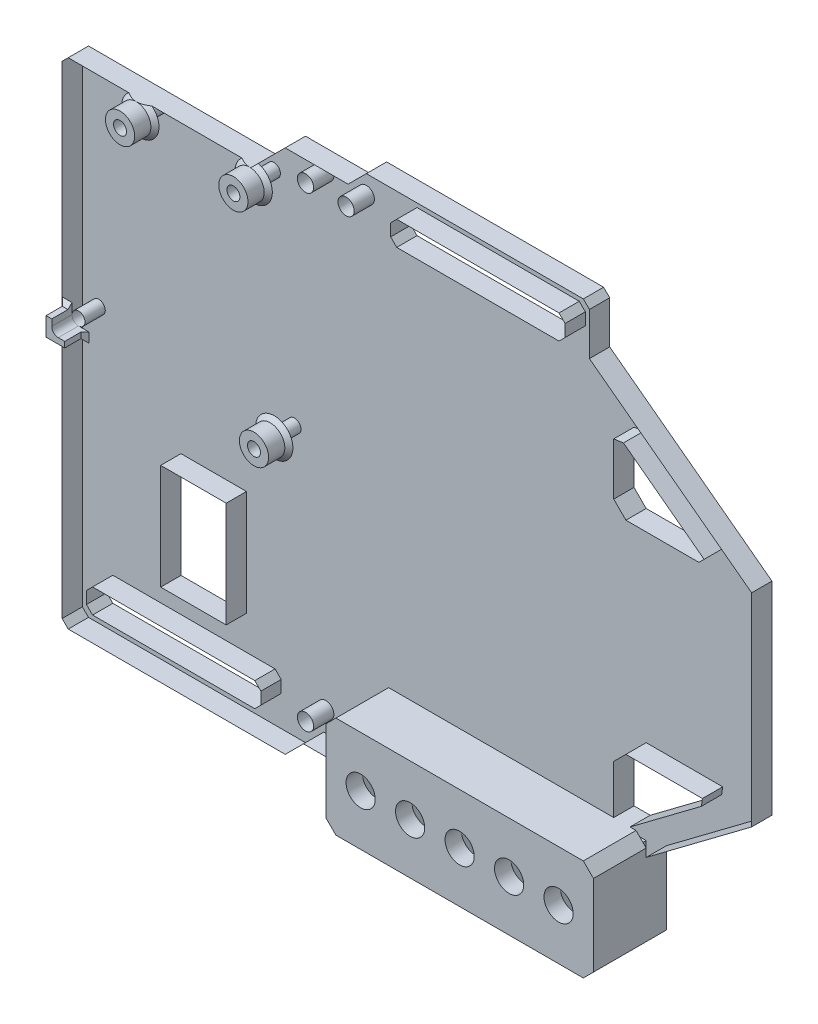
from build123d import *
from OCP.BRepFilletAPI import BRepFilletAPI_MakeChamfer

# Parameters (mm, degrees)
SKETCH1_R           = 2
BOSS_EXTRUDE1_DEPTH = 5
SKETCH4_R           = 3.6
SKETCH4_R_2         = 1.6
BOSS_EXTRUDE2_DEPTH = 5
CUT_EXTRUDE1_START  = -10
SKETCH5_R           = 1.6
SKETCH5_R_2         = 1.5972034
CUT_EXTRUDE1_DEPTH  = 10
CHAMFER1_SIZE       = 1
SKETCH6_W           = 16.15
SKETCH6_H           = 26
CUT_EXTRUDE2_DEPTH  = 10
BOSS_EXTRUDE3_DEPTH = 5
CHAMFER3_SIZE       = 3
CHAMFER3_SIZE2      = 2.142857143
SKETCH10_W          = 43
SKETCH10_H          = 6
CUT_EXTRUDE3_DEPTH  = 10
CHAMFER4_SIZE       = 1.5
SKETCH11_W          = 66
SKETCH11_H          = 25
BOSS_EXTRUDE4_DEPTH = 13
SKETCH12_W          = 66
SKETCH12_H          = 25
BOSS_EXTRUDE5_DEPTH = 5
CUT_EXTRUDE4_START  = -4
SKETCH13_W          = 7.2
SKETCH13_H          = 13.2
CUT_EXTRUDE4_DEPTH  = 14
SKETCH15_R          = 3.6
CUT_EXTRUDE6_DEPTH  = 18
BOSS_EXTRUDE6_DEPTH = 5
CHAMFER5_SIZE       = 2.5


with BuildPart() as part:
    # Sketch1 → Boss-Extrude1 (new body)
    with BuildSketch(Plane.XY):
        Polygon((65, -55), (17.5, -55), (10, -62.5), (-10, -62.5), (-17.5, -55), (-65, -55), (-65, 55), (-17.5, 55), (-10, 62.5), (10, 62.5), (17.5, 55), (65, 55), align=None)
        with Locations((-5, 57.5)):
            Circle(SKETCH1_R, mode=Mode.SUBTRACT)
        with Locations(Location((5, 57.5, 0), (0, 0, 180))):
            Circle(SKETCH1_R, mode=Mode.SUBTRACT)
        with Locations((5, -57.5)):
            Circle(SKETCH1_R, mode=Mode.SUBTRACT)
        with Locations(Location((-5, -57.5, 0), (0, 0, 180))):
            Circle(SKETCH1_R, mode=Mode.SUBTRACT)
    extrude(amount=BOSS_EXTRUDE1_DEPTH)

    # Sketch4 → Boss-Extrude2 (add)
    # profile 1 of 4: a face of its own
    with BuildSketch(Plane.XY.offset(5)):
        with BuildLine():
            Line((-62.56, 2.2), (-63.96, 2.2))
            Line((-63.96, 2.2), (-63.96, -2.4))
            Line((-63.96, -2.4), (-59.36, -2.4))
            Line((-59.36, -2.4), (-59.36, -1))
            Line((-59.36, -1), (-60.96, -1))
            ThreePointArc((-60.96, -1), (-62.09137085, -0.53137085), (-62.56, 0.6))
            Line((-62.56, 0.6), (-62.56, 2.2))
        make_face()
    # profile 2 of 4: a face of its own
    with BuildSketch(Plane.XY.offset(5)):
        with Locations(Location((-12.7, -0.64, 0), (0, 0, 180))):
            Circle(SKETCH4_R)
        with Locations((-12.7, -0.64)):
            Circle(SKETCH4_R_2, mode=Mode.SUBTRACT)
    # profile 3 of 4: a face of its own
    with BuildSketch(Plane.XY.offset(5)):
        with Locations(Location((-17.78, 51.4, 0), (0, 0, 90))):
            Circle(SKETCH4_R)
        with Locations((-17.78, 51.4)):
            Circle(SKETCH4_R_2, mode=Mode.SUBTRACT)
    # profile 4 of 4: a face of its own
    with BuildSketch(Plane.XY.offset(5)):
        with Locations(Location((-45.72, 51.4, 0), (0, 0, 90))):
            Circle(SKETCH4_R)
        with Locations((-45.72, 51.4)):
            Circle(SKETCH4_R_2, mode=Mode.SUBTRACT)
    extrude(amount=BOSS_EXTRUDE2_DEPTH)

    # Sketch5 → Cut-Extrude1 (cut)
    with BuildSketch(Plane.XY.offset(10).offset(CUT_EXTRUDE1_START)):
        with Locations(Location((-45.72, 51.4, 0), (0, 0, 180))):
            Circle(SKETCH5_R)
        with Locations(Location((-17.78, 51.4, 0), (0, 0, 180))):
            Circle(SKETCH5_R)
        with Locations(Location((-12.7, -0.64, 0), (0, 0, 180))):
            Circle(SKETCH5_R)
        with Locations(Location((-60.962264225, 0.59835858, 0), (0, 0, 215.939730973))):
            Circle(SKETCH5_R_2)
    extrude(amount=CUT_EXTRUDE1_DEPTH, mode=Mode.SUBTRACT)

    # Chamfer1
    # the kernel refuses this chamfer: 1 mm, written as the material it adds along each edge
    with BuildSketch(Plane(origin=(-63.96, 2.2, 5), x_dir=(-0.9996219169112968, 0, -0.027495876610586795), z_dir=(0, -1, 0)), Plane(origin=(-63.96, -2.4, 5), x_dir=(0, -0.9996219169112968, -0.027495876610586487), z_dir=(1, 0, 0))) as chamfer1_piece_1:
        Polygon((CHAMFER1_SIZE * 0.999621916911, -CHAMFER1_SIZE * 0.0274958766106), (-CHAMFER1_SIZE * 0.0274958766106, -CHAMFER1_SIZE * 0.999621916911), (0, 0), align=None)
    extrude(amount=4.6)
    with BuildSketch(Plane(origin=(-59.36, -2.4, 5), x_dir=(0.9996219169112968, 0, -0.027495876610586414), z_dir=(0, 1, 0)), Plane(origin=(-62.56, 2.2, 5), x_dir=(0, 0.9996219169112968, -0.027495876610586487), z_dir=(-1, 0, 0))) as chamfer1_piece_2:
        Polygon((CHAMFER1_SIZE * 0.999621916911, -CHAMFER1_SIZE * 0.0274958766106), (-CHAMFER1_SIZE * 0.0274958766106, -CHAMFER1_SIZE * 0.999621916911), (0, 0), align=None)
    extrude(amount=1.4)
    with BuildSketch(Plane(origin=(-12.7, -0.64, 5), x_dir=(-1, 0, 0), z_dir=(0, 1, 0))) as chamfer1_piece_3:
        Polygon((3.6 + CHAMFER1_SIZE, 0), (3.6, CHAMFER1_SIZE), (3.6, 0), align=None)
    revolve(axis=Axis((-12.7, -0.64, 5), (0, 0, 1)))
    with BuildSketch(Plane(origin=(-17.78, 51.4, 5), x_dir=(0, 1, 0), z_dir=(1, 0, 0))) as chamfer1_piece_4_section:
        Polygon((3.6 + CHAMFER1_SIZE, 0), (3.6, CHAMFER1_SIZE), (3.6, 0), align=None)
    chamfer1_piece_4 = revolve(axis=Axis((-17.78, 51.4, 5), (0, 0, 1)), mode=Mode.PRIVATE)
    chamfer1_piece_4 = split(chamfer1_piece_4, bisect_by=Plane(origin=(-20.090607532, 52.409392468, 5.333813393), z_dir=(-0.7071067811865521, 0.707106781186543, 0)), keep=Keep.TOP, mode=Mode.PRIVATE)
    chamfer1_piece_4 = split(chamfer1_piece_4, bisect_by=Plane(origin=(-20.897674884, 55, 5.333813393), z_dir=(0, -1, 0)), keep=Keep.TOP, mode=Mode.PRIVATE)
    add(chamfer1_piece_4)
    with BuildSketch(Plane(origin=(-17.78, 51.4, 5), x_dir=(0, 1, 0), z_dir=(1, 0, 0))) as chamfer1_piece_5_section:
        Polygon((3.6 + CHAMFER1_SIZE, 0), (3.6, CHAMFER1_SIZE), (3.6, 0), align=None)
    chamfer1_piece_5 = revolve(axis=Axis((-17.78, 51.4, 5), (0, 0, 1)), mode=Mode.PRIVATE)
    chamfer1_piece_5 = split(chamfer1_piece_5, bisect_by=Plane(origin=(-16.893463723, 55.606536277, 5.257332972), z_dir=(0.7071067811865521, -0.707106781186543, 0)), keep=Keep.TOP, mode=Mode.PRIVATE)
    chamfer1_piece_5 = split(chamfer1_piece_5, bisect_by=Plane(origin=(-16.518343034, 55, 5.257332972), z_dir=(0, 1, 0)), keep=Keep.TOP, mode=Mode.PRIVATE)
    add(chamfer1_piece_5)
    with BuildSketch(Plane(origin=(-17.78, 51.4, 5), x_dir=(0, 1, 0), z_dir=(1, 0, 0))) as chamfer1_piece_6_section:
        Polygon((3.6 + CHAMFER1_SIZE, 0), (3.6, CHAMFER1_SIZE), (3.6, 0), align=None)
    chamfer1_piece_6 = revolve(axis=Axis((-17.78, 51.4, 5), (0, 0, 1)), mode=Mode.PRIVATE)
    chamfer1_piece_6 = split(chamfer1_piece_6, bisect_by=Plane(origin=(-19.44, 53.06, 5.485263694), z_dir=(0.7071067811865521, -0.707106781186543, 0)), keep=Keep.TOP, mode=Mode.PRIVATE)
    chamfer1_piece_6 = split(chamfer1_piece_6, bisect_by=Plane(origin=(-14.891282339, 55, 5.485263694), z_dir=(0, -1, 0)), keep=Keep.TOP, mode=Mode.PRIVATE)
    add(chamfer1_piece_6)
    with BuildSketch(Plane(origin=(-45.72, 51.4, 5), x_dir=(0, 1, 0), z_dir=(1, 0, 0))) as chamfer1_piece_7_section:
        Polygon((3.6 + CHAMFER1_SIZE, 0), (3.6, CHAMFER1_SIZE), (3.6, 0), align=None)
    chamfer1_piece_7 = revolve(axis=Axis((-45.72, 51.4, 5), (0, 0, 1)), mode=Mode.PRIVATE)
    chamfer1_piece_7 = split(chamfer1_piece_7, bisect_by=Plane(origin=(-45.72, 55, 5.483834366), z_dir=(0, -1, 0)), keep=Keep.TOP, mode=Mode.PRIVATE)
    add(chamfer1_piece_7)
    with BuildSketch(Plane(origin=(-63.96, 4.771682988, 5), x_dir=(-0.9996219169112968, 0, -0.027495876610586795), z_dir=(0, -1, 0))) as chamfer1_piece_8a_section:
        Polygon((CHAMFER1_SIZE * 0.999621916911, -CHAMFER1_SIZE * 0.0274958766106), (-CHAMFER1_SIZE * 0.0274958766106, -CHAMFER1_SIZE * 0.999621916911), (0, 0), align=None)
    chamfer1_piece_8a = extrude(amount=7.171682988, mode=Mode.PRIVATE)
    chamfer1_piece_8a = split(chamfer1_piece_8a, bisect_by=Plane(origin=(-64.289793627, 2.2, 5.329793627), z_dir=(0, 1, 0)), keep=Keep.TOP, mode=Mode.PRIVATE)
    with BuildSketch(Plane(origin=(-62.56, 2.2, 5), x_dir=(0, 0.9996219169112968, -0.027495876610586487), z_dir=(-1, 0, 0))) as chamfer1_piece_8b_section:
        Polygon((CHAMFER1_SIZE * 0.999621916911, -CHAMFER1_SIZE * 0.0274958766106), (-CHAMFER1_SIZE * 0.0274958766106, -CHAMFER1_SIZE * 0.999621916911), (0, 0), align=None)
    chamfer1_piece_8b = extrude(amount=3.971682988, mode=Mode.PRIVATE)
    chamfer1_piece_8b = split(chamfer1_piece_8b, bisect_by=Plane(origin=(-65, 2.529793627, 5.329793627), z_dir=(1, 0, 0)), keep=Keep.TOP, mode=Mode.PRIVATE)
    chamfer1_piece_8b = split(chamfer1_piece_8b, bisect_by=Plane(origin=(-63.96, 2.529793627, 5.329793627), z_dir=(-1, 0, 0)), keep=Keep.TOP, mode=Mode.PRIVATE)
    chamfer1_piece_8 = chamfer1_piece_8a & chamfer1_piece_8b
    add(chamfer1_piece_8)
    with BuildSketch(Plane(origin=(-66.531682988, -2.4, 5), x_dir=(0, -0.9996219169112968, -0.027495876610586487), z_dir=(1, 0, 0))) as chamfer1_piece_9a_section:
        Polygon((CHAMFER1_SIZE * 0.999621916911, -CHAMFER1_SIZE * 0.0274958766106), (-CHAMFER1_SIZE * 0.0274958766106, -CHAMFER1_SIZE * 0.999621916911), (0, 0), align=None)
    chamfer1_piece_9a = extrude(amount=7.171682988, mode=Mode.PRIVATE)
    chamfer1_piece_9a = split(chamfer1_piece_9a, bisect_by=Plane(origin=(-65, -2.729793627, 5.329793627), z_dir=(1, 0, 0)), keep=Keep.TOP, mode=Mode.PRIVATE)
    chamfer1_piece_9a = split(chamfer1_piece_9a, bisect_by=Plane(origin=(-63.96, -2.729793627, 5.329793627), z_dir=(-1, 0, 0)), keep=Keep.TOP, mode=Mode.PRIVATE)
    with BuildSketch(Plane(origin=(-63.96, 2.2, 5), x_dir=(-0.9996219169112968, 0, -0.027495876610586795), z_dir=(0, -1, 0))) as chamfer1_piece_9b_section:
        Polygon((CHAMFER1_SIZE * 0.999621916911, -CHAMFER1_SIZE * 0.0274958766106), (-CHAMFER1_SIZE * 0.0274958766106, -CHAMFER1_SIZE * 0.999621916911), (0, 0), align=None)
    chamfer1_piece_9b = extrude(amount=7.171682988, mode=Mode.PRIVATE)
    chamfer1_piece_9b = split(chamfer1_piece_9b, bisect_by=Plane(origin=(-64.289793627, -2.4, 5.329793627), z_dir=(0, -1, 0)), keep=Keep.TOP, mode=Mode.PRIVATE)
    chamfer1_piece_9 = chamfer1_piece_9a & chamfer1_piece_9b
    add(chamfer1_piece_9)
    with BuildSketch(Plane(origin=(-59.36, -4.971682988, 5), x_dir=(0.9996219169112968, 0, -0.027495876610586414), z_dir=(0, 1, 0))) as chamfer1_piece_10a_section:
        Polygon((CHAMFER1_SIZE * 0.999621916911, -CHAMFER1_SIZE * 0.0274958766106), (-CHAMFER1_SIZE * 0.0274958766106, -CHAMFER1_SIZE * 0.999621916911), (0, 0), align=None)
    chamfer1_piece_10a = extrude(amount=3.971682988, mode=Mode.PRIVATE)
    chamfer1_piece_10a = split(chamfer1_piece_10a, bisect_by=Plane(origin=(-59.030206373, -2.4, 5.329793627), z_dir=(0, -1, 0)), keep=Keep.TOP, mode=Mode.PRIVATE)
    with BuildSketch(Plane(origin=(-63.96, -2.4, 5), x_dir=(0, -0.9996219169112968, -0.027495876610586487), z_dir=(1, 0, 0))) as chamfer1_piece_10b_section:
        Polygon((CHAMFER1_SIZE * 0.999621916911, -CHAMFER1_SIZE * 0.0274958766106), (-CHAMFER1_SIZE * 0.0274958766106, -CHAMFER1_SIZE * 0.999621916911), (0, 0), align=None)
    chamfer1_piece_10b = extrude(amount=7.171682988, mode=Mode.PRIVATE)
    chamfer1_piece_10b = split(chamfer1_piece_10b, bisect_by=Plane(origin=(-59.36, -2.729793627, 5.329793627), z_dir=(1, 0, 0)), keep=Keep.TOP, mode=Mode.PRIVATE)
    chamfer1_piece_10 = chamfer1_piece_10a & chamfer1_piece_10b
    add(chamfer1_piece_10)

    # Sketch6 → Cut-Extrude2 (cut)
    with BuildSketch(Plane.XY.offset(5)):
        with Locations((-32.625, -33.64)):
            Rectangle(SKETCH6_W, SKETCH6_H)
    extrude(amount=-CUT_EXTRUDE2_DEPTH, mode=Mode.SUBTRACT)

    # Sketch9 → Boss-Extrude3 (add)
    # profile 1 of 3: a face of its own
    with BuildSketch(Plane.XY.offset(5)):
        Polygon((105, -25), (65, -55), (65, 55), (105, 25), align=None)
        Polygon((71, 43), (71, 25), (95, 25), align=None, mode=Mode.SUBTRACT)
        Polygon((71, -25), (95, -25), (71, -43), align=None, mode=Mode.SUBTRACT)
    # profile 2 of 3: a face of its own
    with BuildSketch(Plane.XY.offset(5)):
        Polygon((17.5, 55), (65, 55), (65, 67), (10, 67), (5.5, 62.5), (10, 62.5), align=None)
    # profile 3 of 3: a face of its own
    with BuildSketch(Plane.XY.offset(5)):
        Polygon((-17.5, -55), (-65, -55), (-65, -67), (-10, -67), (-5.5, -62.5), (-10, -62.5), align=None)
    extrude(amount=-BOSS_EXTRUDE3_DEPTH)

    # Chamfer3: one chamfer whose edges measure the first distance from different faces: ONE call of the kernel's chamfer builder (chamfer() names one face for all edges)
    chamfer3_edges_1 = [part.edges().sort_by_distance(p)[0] for p in [
        (95, 25, 2.5),
    ]]
    chamfer3_side_1 = [part.faces().sort_by_distance(p)[0] for p in [
        (83, 25, 2.5),
    ]]
    chamfer3_edges_2 = [part.edges().sort_by_distance(p)[0] for p in [
        (71, 25, 2.5),
        (71, -25, 2.5),
    ]]
    chamfer3_edges_3 = [part.edges().sort_by_distance(p)[0] for p in [
        (71, 43, 2.5),
    ]]
    chamfer3_side_3 = [part.faces().sort_by_distance(p)[0] for p in [
        (83, 34, 2.5),
    ]]
    chamfer3_edges_4 = [part.edges().sort_by_distance(p)[0] for p in [
        (71, -43, 2.5),
    ]]
    chamfer3_side_4 = [part.faces().sort_by_distance(p)[0] for p in [
        (71, -34, 2.5),
    ]]
    chamfer3_edges_5 = [part.edges().sort_by_distance(p)[0] for p in [
        (95, -25, 2.5),
    ]]
    chamfer3_side_5 = [part.faces().sort_by_distance(p)[0] for p in [
        (83, -34, 2.5),
    ]]
    chamfer3 = BRepFilletAPI_MakeChamfer(part.part.solid().wrapped)
    for e in chamfer3_edges_1:
        chamfer3.Add(CHAMFER3_SIZE, CHAMFER3_SIZE2, e.wrapped, chamfer3_side_1[0].wrapped)  # the first distance lies on this face
    for e in chamfer3_edges_2:
        chamfer3.Add(CHAMFER3_SIZE, e.wrapped)
    for e in chamfer3_edges_3:
        chamfer3.Add(CHAMFER3_SIZE, CHAMFER3_SIZE2, e.wrapped, chamfer3_side_3[0].wrapped)  # the first distance lies on this face
    for e in chamfer3_edges_4:
        chamfer3.Add(CHAMFER3_SIZE, CHAMFER3_SIZE2, e.wrapped, chamfer3_side_4[0].wrapped)  # the first distance lies on this face
    for e in chamfer3_edges_5:
        chamfer3.Add(CHAMFER3_SIZE, CHAMFER3_SIZE2, e.wrapped, chamfer3_side_5[0].wrapped)  # the first distance lies on this face
    add(Compound.cast(chamfer3.Shape()), mode=Mode.REPLACE)

    # Sketch10 → Cut-Extrude3 (cut)
    with BuildSketch(Plane.XY.offset(5)):
        with Locations((-37.5, -58)):
            Rectangle(SKETCH10_W, SKETCH10_H)
        with Locations((37.5, 58)):
            Rectangle(SKETCH10_W, SKETCH10_H)
    extrude(amount=-CUT_EXTRUDE3_DEPTH, mode=Mode.SUBTRACT)

    # Chamfer4
    chamfer4_edges = [part.edges().sort_by_distance(p)[0] for p in [
        (65, 67, 2.5),
        (-65, 55, 2.5),
        (-65, -67, 2.5),
        (-59, -61, 2.5),
        (-59, -55, 2.5),
        (-16, -55, 2.5),
        (-16, -61, 2.5),
        (59, 61, 2.5),
        (59, 55, 2.5),
        (16, 55, 2.5),
        (16, 61, 2.5),
    ]]
    chamfer(chamfer4_edges, length=CHAMFER4_SIZE)

    # Sketch11 → Boss-Extrude4 (add)
    with BuildSketch(Plane.XY.offset(5)):
        with Locations((46, -52.5)):
            Rectangle(SKETCH11_W, SKETCH11_H)
    extrude(amount=BOSS_EXTRUDE4_DEPTH)

    # Sketch12 → Boss-Extrude5 (add)
    with BuildSketch(Plane(origin=(0, 0, 5), x_dir=(-1, 0, 0), z_dir=(0, 0, -1))):
        with Locations((-46, -52.5)):
            Rectangle(SKETCH12_W, SKETCH12_H)
    extrude(amount=BOSS_EXTRUDE5_DEPTH)

    # Sketch13 → Cut-Extrude4 (cut)
    with BuildSketch(Plane.XY.offset(18).offset(CUT_EXTRUDE4_START)):
        with Locations((33.8, -52.5)):
            Rectangle(SKETCH13_W, SKETCH13_H)
        with Locations((21.6, -52.5)):
            Rectangle(SKETCH13_W, SKETCH13_H)
        with Locations((58.2, -52.5)):
            Rectangle(SKETCH13_W, SKETCH13_H)
        with Locations((46, -52.5)):
            Rectangle(SKETCH13_W, SKETCH13_H)
        with Locations((70.4, -52.5)):
            Rectangle(SKETCH13_W, SKETCH13_H)
    extrude(amount=-CUT_EXTRUDE4_DEPTH, mode=Mode.SUBTRACT)

    # Sketch15 → Cut-Extrude6 (cut)
    with BuildSketch(Plane(origin=(0, 0, 0), x_dir=(-1, 0, 0), z_dir=(0, 0, -1))):
        with Locations((-70.4, -52.5)):
            Circle(SKETCH15_R)
        with Locations((-58.2, -52.5)):
            Circle(SKETCH15_R)
        with Locations((-46, -52.5)):
            Circle(SKETCH15_R)
        with Locations((-33.8, -52.5)):
            Circle(SKETCH15_R)
        with Locations((-21.6, -52.5)):
            Circle(SKETCH15_R)
    extrude(amount=-CUT_EXTRUDE6_DEPTH, mode=Mode.SUBTRACT)

    # Sketch16 → Boss-Extrude6 (add)
    with BuildSketch(Plane(origin=(0, 0, 0), x_dir=(-1, 0, 0), z_dir=(0, 0, -1))):
        Polygon((-13, -65), (-10, -62.5), (-13, -59.5), align=None)
    extrude(amount=-BOSS_EXTRUDE6_DEPTH)

    # Chamfer5
    chamfer5_edges = [part.edges().sort_by_distance(p)[0] for p in [
        (79, -40, 11.5),
        (13, -40, 11.5),
        (13, -65, 11.5),
        (79, -65, 9),
    ]]
    chamfer(chamfer5_edges, length=CHAMFER5_SIZE)


solid = part.part
